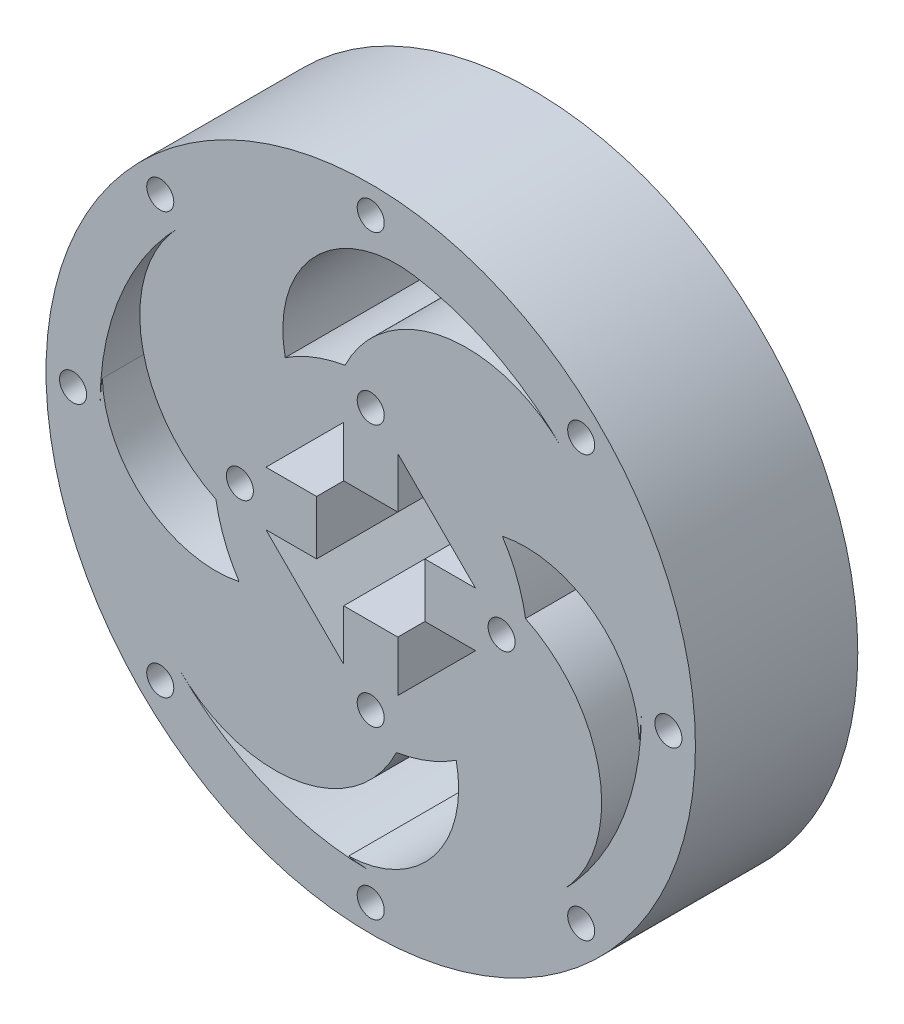
from build123d import *

# Parameters (mm, degrees)
SKETCH6_R                 = 29
SKETCH6_R_2               = 20
INNER_RING_DEPTH          = 30
MOTOR_CONNECTOR_CUT_DEPTH = 30
M3_HOLES_DEPTH            = 38
M3_HOLES_DEPTH_BACK       = 100
SKETCH8_R                 = 2.5
MIDDLE_PATTERN_DEPTH      = 30
SKETCH9_R                 = 60
SKETCH9_R_2               = 50
SKETCH9_R_3               = 2.5
BOSS_EXTRUDE1_DEPTH       = 30
BOSS_EXTRUDE2_DEPTH       = 30


with BuildPart() as part:
    # Sketch6 → Inner Ring (new body)
    with BuildSketch(Plane.XY):
        Circle(SKETCH6_R)
        Circle(SKETCH6_R_2, mode=Mode.SUBTRACT)
    extrude(amount=-INNER_RING_DEPTH)

    # Sketch7 → Motor Connector Cut (add)
    with BuildSketch(Plane.XY):
        with BuildLine():
            Line((-9.999996731, -5), (-9.999996731, 5))
            Line((-9.999996731, 5), (-19.364916731, 5))
            ThreePointArc((-19.364916731, 5), (-20, 0), (-19.364916731, -5))
            Line((-19.364916731, -5), (-9.999996731, -5))
        make_face()
        with BuildLine():
            ThreePointArc((5, 19.364916731), (0, 20), (-5, 19.364916731))
            Line((-5, 19.364916731), (-5, 9.999996731))
            Line((-5, 9.999996731), (5, 9.999996731))
            Line((5, 9.999996731), (5, 19.364916731))
        make_face()
        with BuildLine():
            Line((-5, -9.999996731), (-5, -19.364916731))
            ThreePointArc((-5, -19.364916731), (0, -20), (5, -19.364916731))
            Line((5, -19.364916731), (5, -9.999996731))
            Line((5, -9.999996731), (-5, -9.999996731))
        make_face()
        with BuildLine():
            ThreePointArc((19.364916731, -5), (20, 0), (19.364916731, 5))
            Line((19.364916731, 5), (9.999996731, 5))
            Line((9.999996731, 5), (9.999996731, -5))
            Line((9.999996731, -5), (19.364916731, -5))
        make_face()
    extrude(amount=-MOTOR_CONNECTOR_CUT_DEPTH)

    # Sketch8 → M3 Holes (cut, two sides: drawn at the far end of the back side and taken through both)
    with BuildSketch(Plane.XY.offset(-M3_HOLES_DEPTH_BACK)):
        with Locations((0, 24.182458366)):
            Circle(SKETCH8_R)
        with Locations((24.182458366, 0)):
            Circle(SKETCH8_R)
        with Locations((0, -24.182458366)):
            Circle(SKETCH8_R)
        with Locations((-24.182458366, 0)):
            Circle(SKETCH8_R)
    extrude(amount=M3_HOLES_DEPTH + M3_HOLES_DEPTH_BACK, mode=Mode.SUBTRACT)

    # Sketch10 → Middle Pattern (add)
    with BuildSketch(Plane.XY):
        with BuildLine():
            ThreePointArc((28.607215414, 4.756808408), (26.539406056, -11.690163651), (15.800414568, -24.317625284))
            ThreePointArc((15.800414568, -24.317625284), (11.745224483, -41.595013937), (-4.095362954, -49.596795923))
            ThreePointArc((-4.095362954, -49.596795923), (-2.057581903, -49.898955876), (-2.31e-07, -50))
            ThreePointArc((-2.31e-07, -50), (19.134171511, -46.19397667), (35.355339059, -35.355339059))
            ThreePointArc((35.355339059, -35.355339059), (42.321804958, -13.559663633), (28.607215414, 4.756808408))
        make_face()
        with BuildLine():
            ThreePointArc((24.317625284, 15.800414568), (41.595013937, 11.745224483), (49.596795923, -4.095362954))
            ThreePointArc((49.596795923, -4.095362954), (49.898955887, -2.057581788), (50, 0))
            ThreePointArc((50, 0), (46.193976626, 19.134171618), (35.355339059, 35.355339059))
            ThreePointArc((35.355339059, 35.355339059), (13.559663633, 42.321804958), (-4.756808408, 28.607215414))
            ThreePointArc((-4.756808408, 28.607215414), (11.690163651, 26.539406056), (24.317625284, 15.800414568))
        make_face()
        with BuildLine():
            ThreePointArc((8.201394106, 49.322785148), (-15.267827902, 47.611904301), (-35.355339044, 35.355339075))
            ThreePointArc((-35.355339044, 35.355339075), (-42.32180496, 13.559663644), (-28.607215414, -4.756808408))
            ThreePointArc((-28.607215414, -4.756808408), (-26.539406056, 11.690163651), (-15.800414568, 24.317625284))
            ThreePointArc((-15.800414568, 24.317625284), (-10.393277189, 43.149392225), (8.201394106, 49.322785148))
        make_face()
        with BuildLine():
            ThreePointArc((4.756808408, -28.607215414), (-11.690163651, -26.539406056), (-24.317625284, -15.800414568))
            ThreePointArc((-24.317625284, -15.800414568), (-41.595013937, -11.745224483), (-49.596795923, 4.095362954))
            ThreePointArc((-49.596795923, 4.095362954), (-49.898955887, 2.057581788), (-50, 0))
            ThreePointArc((-50, 0), (-46.193976566, -19.134171762), (-35.355338839, -35.35533928))
            ThreePointArc((-35.355338839, -35.35533928), (-13.559663479, -42.321804932), (4.756808408, -28.607215414))
        make_face()
    extrude(amount=-MIDDLE_PATTERN_DEPTH)



with BuildPart() as body_2:
    # Sketch9 → Boss-Extrude1 (new body)
    with BuildSketch(Plane.XY):
        Circle(SKETCH9_R)
        Circle(SKETCH9_R_2, mode=Mode.SUBTRACT)
        with Locations((0, 55)):
            Circle(SKETCH9_R_3, mode=Mode.SUBTRACT)
        with Locations((-38.890872965, 38.890872965)):
            Circle(SKETCH9_R_3, mode=Mode.SUBTRACT)
        with Locations((-55, 0)):
            Circle(SKETCH9_R_3, mode=Mode.SUBTRACT)
        with Locations((-38.890872965, -38.890872965)):
            Circle(SKETCH9_R_3, mode=Mode.SUBTRACT)
        with Locations((0, -55)):
            Circle(SKETCH9_R_3, mode=Mode.SUBTRACT)
        with Locations((38.890872965, -38.890872965)):
            Circle(SKETCH9_R_3, mode=Mode.SUBTRACT)
        with Locations((55, 0)):
            Circle(SKETCH9_R_3, mode=Mode.SUBTRACT)
        with Locations((38.890872965, 38.890872965)):
            Circle(SKETCH9_R_3, mode=Mode.SUBTRACT)
    extrude(amount=-BOSS_EXTRUDE1_DEPTH)


with BuildPart() as part_1:
    add(part.part)

    add(body_2.part)  # Boss-Extrude2 merges body 2
    # Sketch11 → Boss-Extrude2 (add)
    with BuildSketch(Plane.XY):
        with BuildLine():
            Line((-19.364916731, 5), (-5, 19.364916731))
            ThreePointArc((-5, 19.364916731), (-14.142135624, 14.142135624), (-19.364916731, 5))
        make_face()
        with BuildLine():
            Line((5, 19.364916731), (19.364916731, 5))
            ThreePointArc((19.364916731, 5), (14.142135624, 14.142135624), (5, 19.364916731))
        make_face()
        with BuildLine():
            Line((19.364916731, -5), (5, -19.364916731))
            ThreePointArc((5, -19.364916731), (14.142135624, -14.142135624), (19.364916731, -5))
        make_face()
        with BuildLine():
            Line((-5, -19.364916731), (-19.364916731, -5))
            ThreePointArc((-19.364916731, -5), (-14.142135624, -14.142135624), (-5, -19.364916731))
        make_face()
    extrude(amount=-BOSS_EXTRUDE2_DEPTH)


solid = part_1.part
